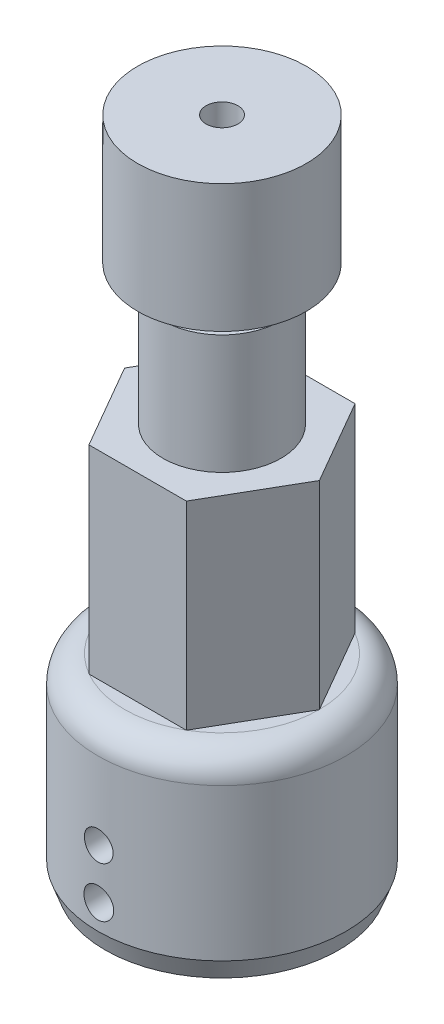
from build123d import *

# Parameters (mm, degrees)
SKETCH1_R               = 5.95
BOSS_EXTRUDE1_DEPTH     = 40
SKETCH1_2_R             = 5.95
BOSS_EXTRUDE2_DEPTH     = 52
SKETCH2_R               = 12.5
BOSS_EXTRUDE3_DEPTH     = 15
CUT_EXTRUDE1_DEPTH      = 55.922672914
CUT_EXTRUDE1_DEPTH_BACK = 55.922672914
SKETCH3_R               = 1.45
SKETCH3_R_2             = 1.5
SKETCH5_R               = 12.5
BOSS_EXTRUDE4_DEPTH     = 5
SKETCH7_R               = 8.5
SKETCH7_R_2             = 6
BOSS_EXTRUDE5_DEPTH     = 15
SKETCH8_R               = 6
SKETCH8_R_2             = 1.6
BOSS_EXTRUDE6_DEPTH     = 3
SKETCH9_R               = 8.5
CUT_EXTRUDE4_DEPTH      = 2.1
BOSS_EXTRUDE7_START     = -20
SKETCH6_R               = 3
SKETCH6_R_2             = 1.5
BOSS_EXTRUDE7_DEPTH     = 20
CHAMFER1_SIZE           = 2.309401077
CHAMFER1_SIZE_2         = 4
FILLET1_R               = 2.7
CHAMFER2_SIZE           = 2
CHAMFER2_SIZE2          = 0.727940469
SKETCH10_W              = 5.6
SKETCH10_H              = 2.5
CUT_EXTRUDE5_DEPTH      = 14
CHAMFER3_SIZE           = 2.5
CHAMFER3_SIZE_2         = 4.330127019


with BuildPart() as part:
    # Sketch1 → Boss-Extrude1 (new body)
    with BuildSketch(Plane(origin=(0, 0, 0), x_dir=(1, 0, 0), z_dir=(0, 1, 0))):
        Polygon((-4.907477288, -8.5), (4.907477288, -8.5), (9.814954576, 0), (4.907477288, 8.5), (-4.907477288, 8.5), (-9.814954576, 0), align=None)
        with Locations(Location((0, 0, 0), (0, 0, 270))):
            Circle(SKETCH1_R, mode=Mode.SUBTRACT)
    extrude(amount=BOSS_EXTRUDE1_DEPTH)

    # Sketch1<2> → Boss-Extrude2 (add)
    with BuildSketch(Plane(origin=(0, 0, 0), x_dir=(1, 0, 0), z_dir=(0, 1, 0))):
        with Locations(Location((0, 0, 0), (0, 0, 270))):
            Circle(SKETCH1_2_R)
        with BuildLine():
            Line((-1.8, 2.4), (1.8, 2.4))
            ThreePointArc((1.8, 2.4), (0, -3), (-1.8, 2.4))
        make_face(mode=Mode.SUBTRACT)
    extrude(amount=BOSS_EXTRUDE2_DEPTH)

    # Sketch2 → Boss-Extrude3 (add)
    with BuildSketch(Plane.XZ):
        with Locations(Location((0, 0, 0), (0, 0, 270))):
            Circle(SKETCH2_R)
        Polygon((4.907477288, 8.5), (-4.907477288, 8.5), (-9.814954576, 0), (-4.907477288, -8.5), (4.907477288, -8.5), (9.814954576, 0), align=None, mode=Mode.SUBTRACT)
    extrude(amount=-BOSS_EXTRUDE3_DEPTH)

    # Sketch3 → Cut-Extrude1 (cut, two sides: drawn at the far end of the back side and taken through both)
    with BuildSketch(Plane.XY.offset(-CUT_EXTRUDE1_DEPTH_BACK)):
        with Locations((0, 9.5)):
            Circle(SKETCH3_R)
        with Locations((0, 4.5)):
            Circle(SKETCH3_R_2)
    extrude(amount=CUT_EXTRUDE1_DEPTH + CUT_EXTRUDE1_DEPTH_BACK, mode=Mode.SUBTRACT)

    # Sketch5 → Boss-Extrude4 (add)
    with BuildSketch(Plane(origin=(0, 15, 0), x_dir=(1, 0, 0), z_dir=(0, 1, 0))):
        with Locations(Location((0, 0, 0), (0, 0, 90))):
            Circle(SKETCH5_R)
        Polygon((9.814954576, 0), (4.907477288, -8.5), (-4.907477288, -8.5), (-9.814954576, 0), (-4.907477288, 8.5), (4.907477288, 8.5), align=None, mode=Mode.SUBTRACT)
    extrude(amount=BOSS_EXTRUDE4_DEPTH)

    # Sketch6 → Boss-Extrude7 (add)
    with BuildSketch(Plane(origin=(0, 52, 0), x_dir=(1, 0, 0), z_dir=(0, 1, 0)).offset(BOSS_EXTRUDE7_START)):
        Circle(SKETCH6_R)
        with Locations(Location((0, 0, 0), (0, 0, 270))):
            Circle(SKETCH6_R_2, mode=Mode.SUBTRACT)
    extrude(amount=BOSS_EXTRUDE7_DEPTH)

    # Chamfer1
    # the kernel refuses this chamfer: 4, 2.309401077 mm, written as the material it takes off along each edge
    with BuildSketch(Plane(origin=(0, 32, 0), x_dir=(0, 0, 1), z_dir=(-1, 0, 0))) as chamfer1_piece_1_section:
        Polygon((1.5 + CHAMFER1_SIZE, 0), (1.5, CHAMFER1_SIZE_2), (1.5, 0), align=None)
    chamfer1_piece_1 = revolve(axis=Axis((0, 32, 0), (0, 1, 0)), mode=Mode.PRIVATE)
    chamfer1_piece_1 = chamfer1_piece_1 & Plane(origin=(0, 34.751058085, 0), x_dir=(0.6000000000000008, 0, -0.7999999999999994), z_dir=(0, -1, 0)) * Cylinder(3, 16, mode=Mode.PRIVATE)
    chamfer1_piece_1 = split(chamfer1_piece_1, bisect_by=Plane(origin=(0, 34.751058085, -2.4), z_dir=(0, 0, 1)), keep=Keep.TOP, mode=Mode.PRIVATE)
    add(chamfer1_piece_1, mode=Mode.SUBTRACT)

    # Fillet1
    # the kernel refuses this fillet: 2.7 mm, written as the material it takes off along each edge
    with BuildSketch(Plane(origin=(0, 20, 0), x_dir=(0, 0, -1), z_dir=(1, 0, 0))) as fillet1_piece_1_section:
        with BuildLine():
            CenterArc((12.5 - FILLET1_R, -FILLET1_R), FILLET1_R, 0, 90)
            Line((12.5, -FILLET1_R), (12.5, 0))
            Line((12.5, 0), (12.5 - FILLET1_R, 0))
        make_face()
    fillet1_piece_1 = revolve(axis=Axis((0, 20, 0), (0, 1, 0)), mode=Mode.PRIVATE)
    fillet1_piece_1 = split(fillet1_piece_1, bisect_by=Plane(origin=(1.041e-06, 19.432642302, -8.5), z_dir=(0, 0, -1)), keep=Keep.TOP, mode=Mode.PRIVATE)
    add(fillet1_piece_1, mode=Mode.SUBTRACT)
    with BuildSketch(Plane(origin=(0, 20, 0), x_dir=(0, 0, -1), z_dir=(1, 0, 0))) as fillet1_piece_2_section:
        with BuildLine():
            CenterArc((12.5 - FILLET1_R, -FILLET1_R), FILLET1_R, 0, 90)
            Line((12.5, -FILLET1_R), (12.5, 0))
            Line((12.5, 0), (12.5 - FILLET1_R, 0))
        make_face()
    fillet1_piece_2 = revolve(axis=Axis((0, 20, 0), (0, 1, 0)), mode=Mode.PRIVATE)
    fillet1_piece_2 = split(fillet1_piece_2, bisect_by=Plane(origin=(-7.361214724, 19.432641737, -4.250002093), z_dir=(-0.8660254037844416, 0, -0.49999999999999484)), keep=Keep.TOP, mode=Mode.PRIVATE)
    add(fillet1_piece_2, mode=Mode.SUBTRACT)
    with BuildSketch(Plane(origin=(0, 20, 0), x_dir=(0, 0, -1), z_dir=(1, 0, 0))) as fillet1_piece_3_section:
        with BuildLine():
            CenterArc((12.5 - FILLET1_R, -FILLET1_R), FILLET1_R, 0, 90)
            Line((12.5, -FILLET1_R), (12.5, 0))
            Line((12.5, 0), (12.5 - FILLET1_R, 0))
        make_face()
    fillet1_piece_3 = revolve(axis=Axis((0, 20, 0), (0, 1, 0)), mode=Mode.PRIVATE)
    fillet1_piece_3 = split(fillet1_piece_3, bisect_by=Plane(origin=(7.361217141, 19.432641737, -4.249997907), z_dir=(0.8660254037844382, 0, -0.5000000000000011)), keep=Keep.TOP, mode=Mode.PRIVATE)
    add(fillet1_piece_3, mode=Mode.SUBTRACT)
    with BuildSketch(Plane(origin=(0, 20, 0), x_dir=(0, 0, -1), z_dir=(1, 0, 0))) as fillet1_piece_4_section:
        with BuildLine():
            CenterArc((12.5 - FILLET1_R, -FILLET1_R), FILLET1_R, 0, 90)
            Line((12.5, -FILLET1_R), (12.5, 0))
            Line((12.5, 0), (12.5 - FILLET1_R, 0))
        make_face()
    fillet1_piece_4 = revolve(axis=Axis((0, 20, 0), (0, 1, 0)), mode=Mode.PRIVATE)
    fillet1_piece_4 = split(fillet1_piece_4, bisect_by=Plane(origin=(-7.361217141, 19.432641737, 4.249997907), z_dir=(-0.8660254037844347, 0, 0.500000000000007)), keep=Keep.TOP, mode=Mode.PRIVATE)
    add(fillet1_piece_4, mode=Mode.SUBTRACT)
    with BuildSketch(Plane(origin=(0, 20, 0), x_dir=(0, 0, -1), z_dir=(1, 0, 0))) as fillet1_piece_5_section:
        with BuildLine():
            CenterArc((12.5 - FILLET1_R, -FILLET1_R), FILLET1_R, 0, 90)
            Line((12.5, -FILLET1_R), (12.5, 0))
            Line((12.5, 0), (12.5 - FILLET1_R, 0))
        make_face()
    fillet1_piece_5 = revolve(axis=Axis((0, 20, 0), (0, 1, 0)), mode=Mode.PRIVATE)
    fillet1_piece_5 = split(fillet1_piece_5, bisect_by=Plane(origin=(7.361214724, 19.432641737, 4.250002093), z_dir=(0.8660254037844416, 0, 0.49999999999999495)), keep=Keep.TOP, mode=Mode.PRIVATE)
    add(fillet1_piece_5, mode=Mode.SUBTRACT)
    with BuildSketch(Plane(origin=(0, 20, 0), x_dir=(0, 0, -1), z_dir=(1, 0, 0))) as fillet1_piece_6_section:
        with BuildLine():
            CenterArc((12.5 - FILLET1_R, -FILLET1_R), FILLET1_R, 0, 90)
            Line((12.5, -FILLET1_R), (12.5, 0))
            Line((12.5, 0), (12.5 - FILLET1_R, 0))
        make_face()
    fillet1_piece_6 = revolve(axis=Axis((0, 20, 0), (0, 1, 0)), mode=Mode.PRIVATE)
    fillet1_piece_6 = split(fillet1_piece_6, bisect_by=Plane(origin=(-2.417e-06, 19.432641737, 8.5), z_dir=(0, 0, 1)), keep=Keep.TOP, mode=Mode.PRIVATE)
    add(fillet1_piece_6, mode=Mode.SUBTRACT)

    # Chamfer2
    chamfer2_edges = [part.edges().sort_by_distance(p)[0] for p in [
        (0, 0, 12.5),
    ]]
    chamfer2_side = [part.faces().sort_by_distance(p)[0] for p in [
        (0, 7.5, 12.5),
    ]]
    chamfer(chamfer2_edges, length=CHAMFER2_SIZE, length2=CHAMFER2_SIZE2, reference=chamfer2_side[0])

    # Sketch10 → Cut-Extrude5 (cut)
    with BuildSketch(Plane.XZ):
        with Locations((0, -7)):
            Rectangle(SKETCH10_W, SKETCH10_H)
        with Locations((0, 7)):
            Rectangle(SKETCH10_W, SKETCH10_H)
    extrude(amount=-CUT_EXTRUDE5_DEPTH, mode=Mode.SUBTRACT)

    # Chamfer3
    # the kernel refuses this chamfer: 4.330127019, 2.5 mm, written as the material it adds along each edge
    with BuildSketch(Plane(origin=(-2.8, 14, -5.75), x_dir=(-0.05789386240267132, -0.9983227437537926, 0), z_dir=(0, 0, -1)), Plane(origin=(2.8, 14, -8.25), x_dir=(0.05789386240267132, -0.9983227437537926, 0), z_dir=(0, 0, 1)), Plane(origin=(2.8, 14, 5.75), x_dir=(0.05789386240267132, -0.9983227437537926, 0), z_dir=(0, 0, 1)), Plane(origin=(-2.8, 14, 8.25), x_dir=(-0.05789386240267132, -0.9983227437537926, 0), z_dir=(0, 0, -1))) as chamfer3_piece_1:
        Polygon((CHAMFER3_SIZE * 0.998322743754, -CHAMFER3_SIZE * 0.0578938624027), (-CHAMFER3_SIZE_2 * 0.0578938624016, -CHAMFER3_SIZE_2 * 0.998322743736), (0, 0), align=None)
    extrude(amount=2.5)


with BuildPart() as body_2:
    # Sketch7 → Boss-Extrude5 (new body)
    with BuildSketch(Plane(origin=(0, 52, 0), x_dir=(1, 0, 0), z_dir=(0, 1, 0))):
        with Locations(Location((0, 0, 0), (0, 0, 270))):
            Circle(SKETCH7_R)
        with Locations(Location((0, 0, 0), (0, 0, 270))):
            Circle(SKETCH7_R_2, mode=Mode.SUBTRACT)
    extrude(amount=BOSS_EXTRUDE5_DEPTH)

    # Sketch8 → Boss-Extrude6 (add)
    with BuildSketch(Plane(origin=(0, 67, 0), x_dir=(1, 0, 0), z_dir=(0, 1, 0))):
        with Locations(Location((0, 0, 0), (0, 0, 270))):
            Circle(SKETCH8_R)
        with Locations(Location((0, 0, 0), (0, 0, 270))):
            Circle(SKETCH8_R_2, mode=Mode.SUBTRACT)
    extrude(amount=-BOSS_EXTRUDE6_DEPTH)

    # Sketch9 → Cut-Extrude4 (cut)
    with BuildSketch(Plane.XZ.offset(-52)):
        with Locations(Location((0, 0, 0), (0, 0, 270))):
            Circle(SKETCH9_R)
    extrude(amount=-CUT_EXTRUDE4_DEPTH, mode=Mode.SUBTRACT)


solid = Compound([part.part, body_2.part])
